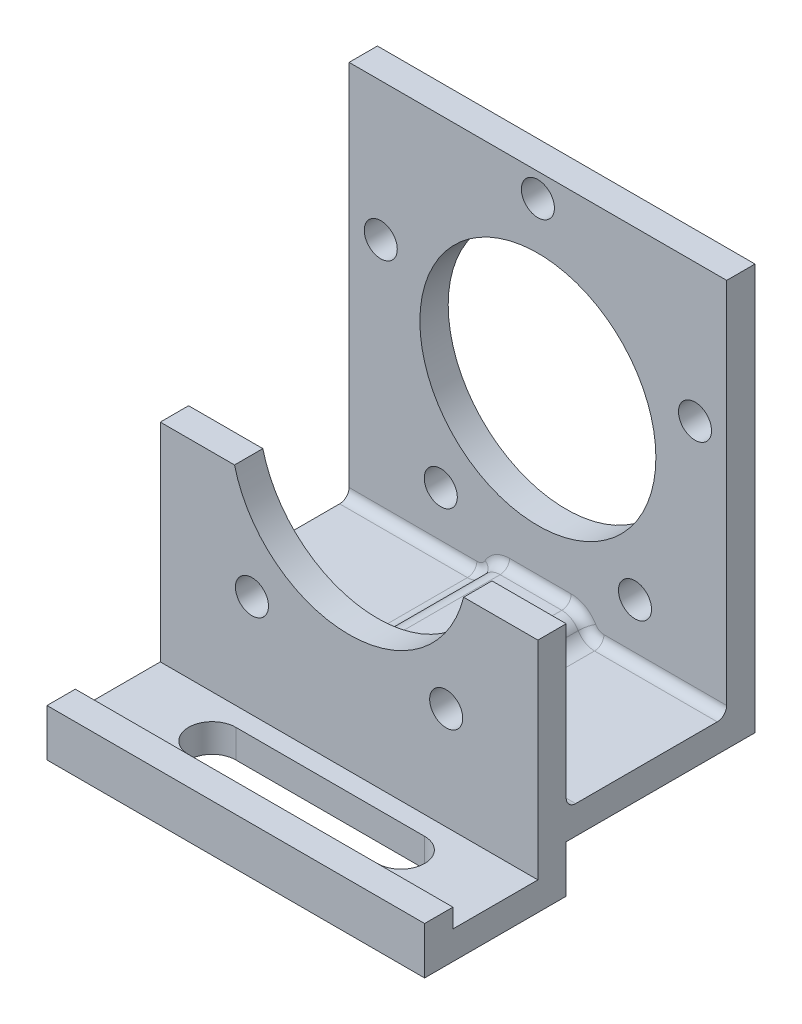
from build123d import *

# Parameters (mm, degrees)
SKETCH1_W           = 40
SKETCH1_H           = 40
BOSS_EXTRUDE1_DEPTH = 3
SKETCH3_W           = 20
SKETCH3_H           = 3
EXTRUDE_THIN1_DEPTH = 20
SKETCH4_W           = 10
SKETCH4_H           = 17
BOSS_EXTRUDE2_DEPTH = 2
EXTRUDE_THIN2_DEPTH = 20
SKETCH6_R           = 12.5
CUT_EXTRUDE1_DEPTH  = 57.789083458
SKETCH7_R           = 1.75
CUT_EXTRUDE2_DEPTH  = 55.990908339
CIRPATTERN1_COUNT   = 5
SKETCH8_R           = 1.75
CUT_EXTRUDE3_DEPTH  = 10
SKETCH9_R           = 1.75
CUT_EXTRUDE4_DEPTH  = 10
CUT_EXTRUDE5_DEPTH  = 59.72818744
FILLET1_R           = 2
FILLET3_R           = 2
FILLET4_R           = 2
FILLET5_R           = 2
FILLET2_R           = 1


with BuildPart() as part:
    # Sketch1 → Boss-Extrude1 (new body)
    with BuildSketch(Plane.XY):
        with Locations((0, 20)):
            Rectangle(SKETCH1_W, SKETCH1_H)
    extrude(amount=-BOSS_EXTRUDE1_DEPTH)

    # Sketch3 → Extrude-Thin1 (add, symmetric)
    with BuildSketch(Plane(origin=(0, 0, 0), x_dir=(0, 0, -1), z_dir=(1, 0, 0))):
        with Locations((-7, -1.5)):
            Rectangle(SKETCH3_W, SKETCH3_H)
    extrude(amount=EXTRUDE_THIN1_DEPTH, both=True)

    # Sketch4 → Boss-Extrude2 (add)
    with BuildSketch(Plane(origin=(0, 0, 0), x_dir=(1, 0, 0), z_dir=(0, 1, 0))):
        with Locations((0, -8.5)):
            Rectangle(SKETCH4_W, SKETCH4_H)
    extrude(amount=BOSS_EXTRUDE2_DEPTH)

    # Sketch5 → Extrude-Thin2 (add, symmetric)
    with BuildSketch(Plane(origin=(0, 0, 0), x_dir=(0, 0, -1), z_dir=(1, 0, 0))):
        Polygon((-17, 17), (-17, -8), (-32, -8), (-32, -3), (-29, -3), (-29, -5), (-20, -5), (-20, 17), align=None)
    extrude(amount=EXTRUDE_THIN2_DEPTH, both=True)

    # Sketch6 → Cut-Extrude1 (cut, through all)
    with BuildSketch(Plane.XY.offset(32)):
        with Locations((0, 20)):
            Circle(SKETCH6_R)
    extrude(amount=-CUT_EXTRUDE1_DEPTH, mode=Mode.SUBTRACT)

    # Sketch7 → Cut-Extrude2 (cut, through all)
    with BuildSketch(Plane.XY):
        with Locations((0, 37.5)):
            Circle(SKETCH7_R)
    cut_extrude2 = extrude(amount=-CUT_EXTRUDE2_DEPTH, mode=Mode.SUBTRACT)

    # CirPattern1: Cut-Extrude2 ×5 about axis
    cirpattern1_axis = Axis((0, 20, 0), (0, 0, 1))
    for i in range(1, CIRPATTERN1_COUNT):
        add(cut_extrude2.rotate(cirpattern1_axis, i * 360 / CIRPATTERN1_COUNT), mode=Mode.SUBTRACT)

    # Sketch8 → Cut-Extrude3 (cut)
    with BuildSketch(Plane.XY.offset(20)):
        with Locations(Location((10.286241915, 5.842202598, 0), (0, 0, 216))):
            Circle(SKETCH8_R)
    extrude(amount=-CUT_EXTRUDE3_DEPTH, mode=Mode.SUBTRACT)

    # Sketch9 → Cut-Extrude4 (cut)
    with BuildSketch(Plane.XY.offset(20)):
        with Locations(Location((-10.286241915, 5.842202598, 0), (0, 0, 144))):
            Circle(SKETCH9_R)
    extrude(amount=-CUT_EXTRUDE4_DEPTH, mode=Mode.SUBTRACT)

    # Sketch10 → Cut-Extrude5 (cut, through all)
    with BuildSketch(Plane(origin=(0, -5, 0), x_dir=(1, 0, 0), z_dir=(0, 1, 0))):
        with BuildLine():
            Line((-10, -22), (10, -22))
            ThreePointArc((10, -22), (12.5, -24.5), (10, -27))
            Line((10, -27), (-10, -27))
            ThreePointArc((-10, -27), (-12.5, -24.5), (-10, -22))
        make_face()
    extrude(amount=-CUT_EXTRUDE5_DEPTH, mode=Mode.SUBTRACT)

    # Fillet1
    fillet1_edges = [part.edges().sort_by_distance(p)[0] for p in [
        (5, 0, 8.5),
    ]]
    fillet(fillet1_edges, radius=FILLET1_R - 0.0001)  # a hair under: the kernel refuses the full size

    # Fillet3
    fillet3_edges = [part.edges().sort_by_distance(p)[0] for p in [
        (5, 2, 8.5),
    ]]
    fillet(fillet3_edges, radius=FILLET3_R)

    # Fillet4
    fillet4_edges = [part.edges().sort_by_distance(p)[0] for p in [
        (-5, 2, 8.5),
    ]]
    fillet(fillet4_edges, radius=FILLET4_R - 0.0001)  # a hair under: the kernel refuses the full size

    # Fillet5
    fillet5_edges = [part.edges().sort_by_distance(p)[0] for p in [
        (-5, 0, 8.5),
    ]]
    fillet(fillet5_edges, radius=FILLET5_R)

    # Fillet2
    fillet2_edges = [part.edges().sort_by_distance(p)[0] for p in [
        (13.49995, 0, 0),
        (5.9999375, 0.267943012, 17),
        (0.26787806, 2, 0),
        (5.9999375, 0.267943012, 0),
        (4.535868621, 1.73204359, 0),
        (4.535868621, 1.73204359, 17),
        (0.26787806, 2, 17),
        (-4.0000625, 1.732056988, 17),
        (-4.0000625, 1.732056988, 0),
        (-13.23207194, 0, 17),
        (-5.464131379, 0.26795641, 17),
        (-5.464131379, 0.26795641, 0),
        (13.49995, 0, 17),
        (-13.23207194, 0, 0),
    ]]
    fillet(fillet2_edges, radius=FILLET2_R)


solid = part.part
